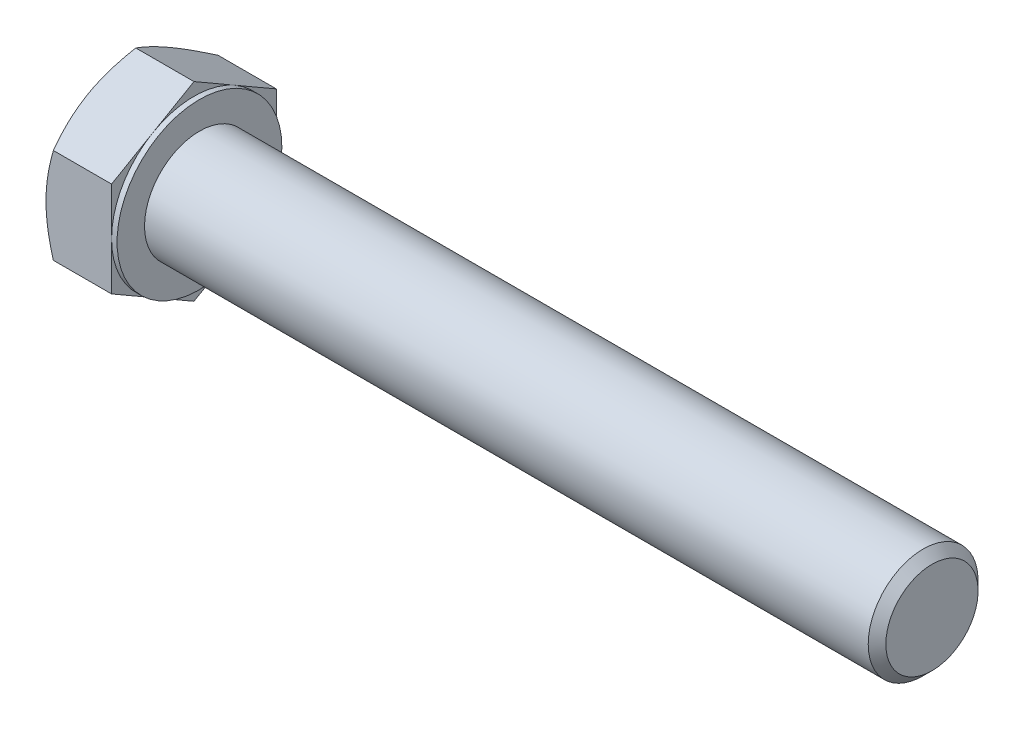
from build123d import *

# Parameters (mm, degrees)
BASEHEAD_DEPTH   = 7.76
INDENT_OUTLINE_R = 7.875
INDENT_DEPTH     = 0.97
SKETCH4_W        = 0.6
SKETCH4_H        = 11.392304845


# Read off the part's stored shape, not the designer's step: Indent
with BuildPart() as part:
    # Sketch1 → BaseHead (new body)
    with BuildSketch(Plane(origin=(0, 0, 0), x_dir=(0, 0, -1), z_dir=(1, 0, 0))):
        Polygon((9, 5.196152423), (9, -5.196152423), (0, -10.392304845), (-9, -5.196152423), (-9, 5.196152423), (0, 10.392304845), align=None)
    extrude(amount=BASEHEAD_DEPTH)

    # BodySke → BaseBody (revolve)
    with BuildSketch(Plane.XY, mode=Mode.PRIVATE) as basebody_sk:
        Polygon((0, 0), (87.76, 0), (87.76, 5.036), (86.796, 6), (0, 6), align=None)
    revolve(basebody_sk.sketch.rotate(Axis((0, 0, 0), (1, 0, 0)), 90), axis=Axis((0, 0, 0), (1, 0, 0)))

    # Indent outline → Indent (cut)
    with BuildSketch(Plane.YZ):
        with Locations((0.192376607, 0.033212245)):
            Circle(INDENT_OUTLINE_R)
    extrude(amount=INDENT_DEPTH, mode=Mode.SUBTRACT)

    # Sketch3 → HeadChamfer (revolve, cut)
    with BuildSketch(Plane.XY):
        Polygon((0, 9), (3.690598923, 15.392304845), (3.690598923, 20.392304845), (-10, 20.392304845), (-10, 9), align=None)
    revolve(axis=Axis((0, 0, 0), (1, 0, 0)), mode=Mode.SUBTRACT)

    # Sketch4 → BearingFace (revolve, cut)
    with BuildSketch(Plane.XY, mode=Mode.PRIVATE) as bearingface_sk:
        with Locations((7.46, 14.696152423)):
            Rectangle(SKETCH4_W, SKETCH4_H)
    revolve(bearingface_sk.sketch.rotate(Axis((0, 0, 0), (1, 0, 0)), 270), axis=Axis((0, 0, 0), (1, 0, 0)), mode=Mode.SUBTRACT)


solid = part.part
